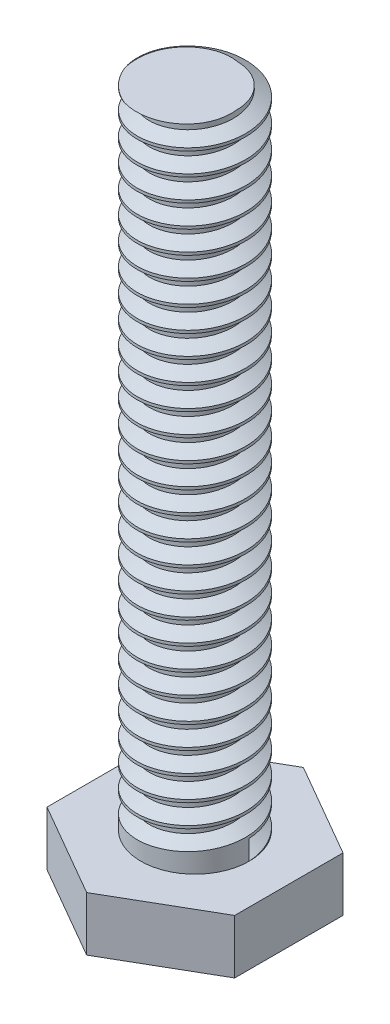
from build123d import *
from build123d.topology import SkipClean

# Parameters (mm, degrees)
SKETCH1_R           = 5.08
BOSS_EXTRUDE1_DEPTH = 60.452
BOSS_EXTRUDE2_DEPTH = 5.08
THREAD1_PITCH       = 2.116666667


with BuildPart() as part:
    # Sketch1 → Boss-Extrude1 (new body)
    with BuildSketch(Plane(origin=(0, 0, 0), x_dir=(1, 0, 0), z_dir=(0, 1, 0))):
        with Locations(Location((0, 0, 0), (0, 0, 270))):
            Circle(SKETCH1_R)
    extrude(amount=BOSS_EXTRUDE1_DEPTH)

    # Sketch2 → Boss-Extrude2 (add)
    with BuildSketch(Plane.XZ):
        Polygon((0, 10.16), (-8.798818102, 5.08), (-8.798818102, -5.08), (0, -10.16), (8.798818102, -5.08), (8.798818102, 5.08), align=None)
    extrude(amount=BOSS_EXTRUDE2_DEPTH)

    # Thread1: the profile of Thread Profile1 profile screwed along a right-hand helix of 57.6 turns, 6 arcs to a turn; built about Z, then put on its axis
    with SkipClean():  # the faces are left unmerged after this step: merging them gives an invalid solid
        thread1_z = Axis((0, 0, 0), (0, 0, 1))
        thread1_corners = [(5.0803, 0, -0.000173205), (5.0803, 0, 1.852256533), (3.934320565, 0, 1.190624997), (3.934320565, 0, 0.66145833)]
        with BuildLine(mode=Mode.PRIVATE) as thread1_profile:
            Line(thread1_corners[0], thread1_corners[1])
            Line(thread1_corners[1], thread1_corners[2])
            Line(thread1_corners[2], thread1_corners[3])
            Line(thread1_corners[3], thread1_corners[0])
        thread1_cap = Face(thread1_profile.wire())
        thread1_turn_angles = [0, 30, 60, 90, 120, 150, 180, 210, 240, 270, 300, 330, 360, 390, 420, 450, 480, 510, 540, 570, 600, 630, 660, 690, 720]
        thread1_turn_weights = [1, 0.8660254037844387, 1, 0.8660254037844387, 1, 0.8660254037844387, 1, 0.8660254037844387, 1, 0.8660254037844387, 1, 0.8660254037844387, 1, 0.8660254037844387, 1, 0.8660254037844387, 1, 0.8660254037844387, 1, 0.8660254037844387, 1, 0.8660254037844387, 1, 0.8660254037844387, 1]
        thread1_turn_rails = [Edge.make_bspline([Vector(p[0], p[1], 0).rotate(thread1_z, thread1_turn_angles[k]) / thread1_turn_weights[k] + Vector(0, 0, p[2] + THREAD1_PITCH * thread1_turn_angles[k] / 360) for k in range(25)], [0, 0, 0, 1, 1, 2, 2, 3, 3, 4, 4, 5, 5, 6, 6, 7, 7, 8, 8, 9, 9, 10, 10, 11, 11, 12, 12, 12], 2, thread1_turn_weights) for p in thread1_corners]
        thread1_turn_sides = [Face.make_surface_from_curves(thread1_turn_rails[p[0]], thread1_turn_rails[p[1]]) for p in [(0, 1), (1, 2), (2, 3), (3, 0)]]
        thread1_last_angles = [20160, 20190, 20220, 20250, 20280, 20310, 20340, 20370, 20400, 20430, 20460, 20490, 20520, 20550, 20580, 20610, 20640, 20670, 20700, 20718, 20736]
        thread1_last_weights = [1, 0.8660254037844387, 1, 0.8660254037844387, 1, 0.8660254037844387, 1, 0.8660254037844387, 1, 0.8660254037844387, 1, 0.8660254037844387, 1, 0.8660254037844387, 1, 0.8660254037844387, 1, 0.8660254037844387, 1, 0.9510565162951438, 1]
        thread1_last_rails = [Edge.make_bspline([Vector(p[0], p[1], 0).rotate(thread1_z, thread1_last_angles[k]) / thread1_last_weights[k] + Vector(0, 0, p[2] + THREAD1_PITCH * thread1_last_angles[k] / 360) for k in range(21)], [0, 0, 0, 1, 1, 2, 2, 3, 3, 4, 4, 5, 5, 6, 6, 7, 7, 8, 8, 9, 9, 10, 10, 10], 2, thread1_last_weights) for p in thread1_corners]
        thread1_last_sides = [Face.make_surface_from_curves(thread1_last_rails[p[0]], thread1_last_rails[p[1]]) for p in [(0, 1), (1, 2), (2, 3), (3, 0)]]
        thread1 = Plane(origin=(0, 0, 0), x_dir=(1, 0, 0), z_dir=(0, 1, 0)) * Solid(Shell([*[p.moved(Location((0, 0, 2 * THREAD1_PITCH * i))) for i in range(28) for p in thread1_turn_sides], *thread1_last_sides, thread1_cap, thread1_cap.rotate(thread1_z, 20736).moved(Location((0, 0, THREAD1_PITCH * 20736 / 360)))]))
        add(thread1, mode=Mode.SUBTRACT)


solid = part.part
